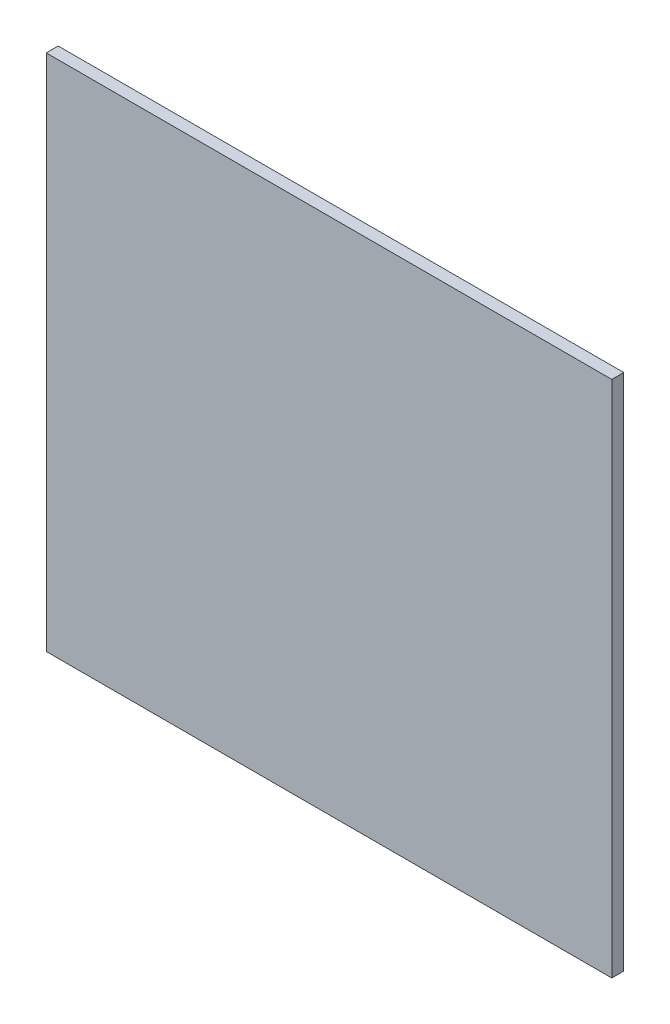
from build123d import *

# Parameters (mm, degrees)
SKETCH1_W           = 300
SKETCH1_H           = 275
BOSS_EXTRUDE1_DEPTH = 6.35


with BuildPart() as part:
    # Sketch1 → Boss-Extrude1 (new body)
    with BuildSketch(Plane.XY):
        Rectangle(SKETCH1_W, SKETCH1_H)
    extrude(amount=BOSS_EXTRUDE1_DEPTH)


solid = part.part
